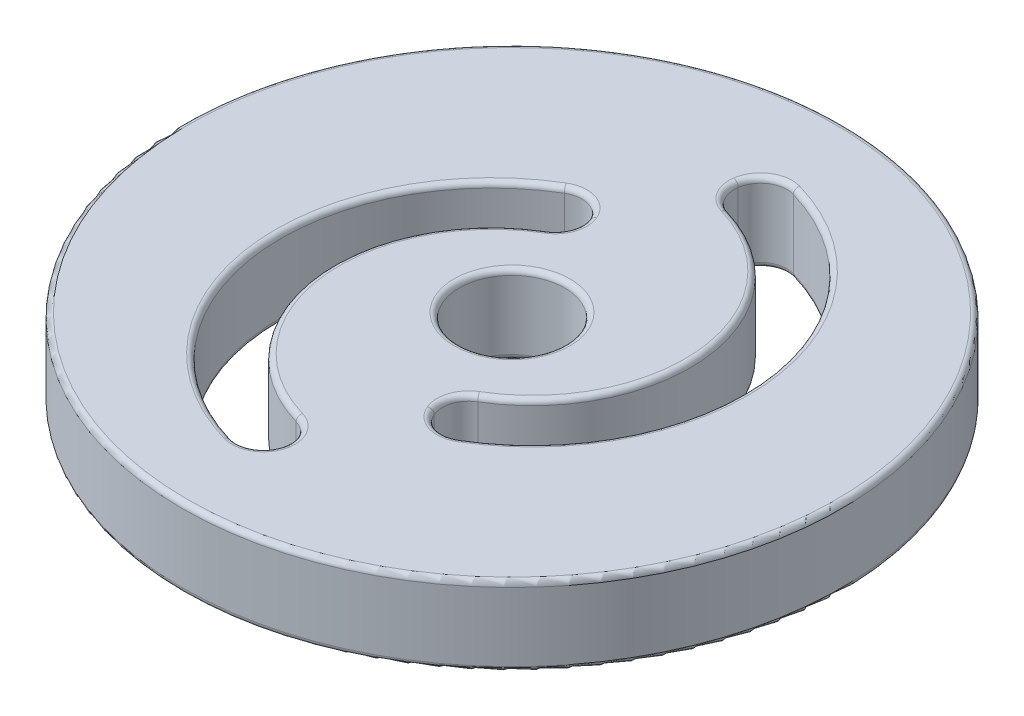
from build123d import *

# Parameters (mm, degrees)
SKETCH_1_R          = 125
SKETCH_1_R_2        = 20
EXTRUDE_1_DEPTH     = 30
CUT_EXTRUDE_1_DEPTH = 30
FILLET_3_R          = 10
FILLET_4_R          = 2


with BuildPart() as part:
    # 草图1 → 凸台-拉伸1 (new body)
    with BuildSketch(Plane(origin=(0, 0, 0), x_dir=(1, 0, 0), z_dir=(0, 1, 0))):
        with Locations(Location((0, 0, 0), (0, 0, 270))):
            Circle(SKETCH_1_R)
        with Locations(Location((0, 0, 0), (0, 0, 270))):
            Circle(SKETCH_1_R_2, mode=Mode.SUBTRACT)
    extrude(amount=EXTRUDE_1_DEPTH)

    # 草图2 → 切除-拉伸1 (cut)
    with BuildSketch(Plane(origin=(0, 30, 0), x_dir=(1, 0, 0), z_dir=(0, 1, 0))):
        with BuildLine():
            Line((1.395674395, 96.50212568), (-1.395674395, 76.69787432))
            ThreePointArc((-1.395674395, 76.69787432), (49.589198145, 25.061305382), (13.255952188, -37.753404024))
            Line((13.255952188, -37.753404024), (20.946062145, -56.215858055))
            ThreePointArc((20.946062145, -56.215858055), (69.427303642, 27.600905796), (1.395674395, 96.50212568))
        make_face()
        with BuildLine():
            Line((-13.255952188, 37.753404024), (-20.946062145, 56.215858055))
            ThreePointArc((-20.946062145, 56.215858055), (-69.427303642, -27.600905796), (-1.395674395, -96.50212568))
            Line((-1.395674395, -96.50212568), (1.395674395, -76.69787432))
            ThreePointArc((1.395674395, -76.69787432), (-49.589198145, -25.061305382), (-13.255952188, 37.753404024))
        make_face()
    extrude(amount=-CUT_EXTRUDE_1_DEPTH, mode=Mode.SUBTRACT)

    # 圆角3
    fillet_3_edges = [part.edges().sort_by_distance(p)[0] for p in [
        (-20.946062145, 15, -56.215858055),
        (-13.255952188, 15, -37.753404024),
        (-1.395674395, 15, 96.50212568),
        (1.395674395, 15, 76.69787432),
        (20.946062145, 15, 56.215858055),
        (13.255952188, 15, 37.753404024),
        (-1.395674395, 15, -76.69787432),
        (1.395674395, 15, -96.50212568),
    ]]
    fillet(fillet_3_edges, radius=FILLET_3_R - 0.0001)  # a hair under: the kernel refuses the full size

    # 圆角4
    fillet_4_edges = [part.edges().sort_by_distance(p)[0] for p in [
        (0, 0, -125),
        (-69.427303642, 30, 27.600905796),
        (-69.427303642, 0, 27.600905796),
        (-49.589198145, 30, 25.061305382),
        (-49.589198145, 0, 25.061305382),
        (69.427303642, 30, -27.600905796),
        (69.427303642, 0, -27.600905796),
        (49.589198145, 30, -25.061305382),
        (49.589198145, 0, -25.061305382),
        (0, 30, -125),
        (-22.920540142, 30, -51.971024611),
        (0, 0, -20),
        (-22.920540142, 0, -51.971024611),
        (-16.559492515, 30, -39.340160323),
        (-16.559492515, 0, -39.340160323),
        (-4.375771536, 30, 92.891558501),
        (-4.375771536, 0, 92.891558501),
        (-1.401623113, 30, 79.065637167),
        (-1.401623113, 0, 79.065637167),
        (0, 30, -20),
        (22.920540142, 30, 51.971024611),
        (22.920540142, 0, 51.971024611),
        (16.559492515, 30, 39.340160323),
        (16.559492515, 0, 39.340160323),
        (1.401623113, 30, -79.065637167),
        (1.401623113, 0, -79.065637167),
        (4.375771536, 30, -92.891558501),
        (4.375771536, 0, -92.891558501),
    ]]
    fillet(fillet_4_edges, radius=FILLET_4_R)


solid = part.part
